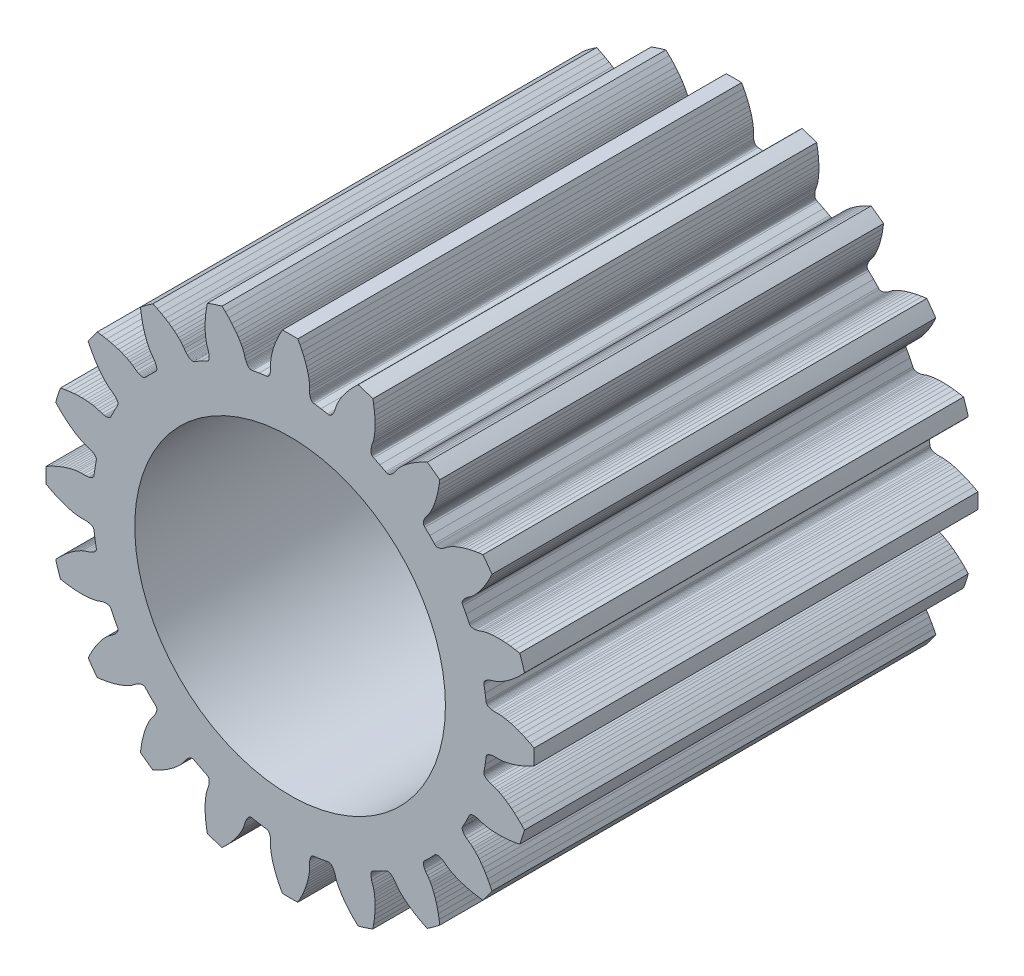
from build123d import *

# Parameters (mm, degrees)
MODEL_R             = 3.5
BOSS_EXTRUDE1_DEPTH = 10


with BuildPart() as part:
    # Model → Boss-Extrude1 (new body)
    with BuildSketch(Plane.XY):
        with BuildLine():
            Line((5.1320181, 1.3822118), (5.2098951, 1.4578457))
            Line((5.2098951, 1.4578457), (5.281849585, 1.533616799))
            ThreePointArc((5.281849585, 1.533616799), (5.230803526, 1.699591125), (5.174543391, 1.863871295))
            Line((5.174543391, 1.863871295), (5.0717939, 1.8828776))
            Line((5.0717939, 1.8828776), (4.9643336, 1.8982917))
            Line((4.9643336, 1.8982917), (4.8642841, 1.9083685))
            Line((4.8642841, 1.9083685), (4.7735596, 1.9136905))
            Line((4.7735596, 1.9136905), (4.6901277, 1.9150965))
            Line((4.6901277, 1.9150965), (4.614373, 1.9131976))
            Line((4.614373, 1.9131976), (4.5492049, 1.9088478))
            Line((4.5492049, 1.9088478), (4.4892589, 1.9023328))
            Line((4.4892589, 1.9023328), (4.4393971, 1.8947494))
            Line((4.4393971, 1.8947494), (4.3987372, 1.8868379))
            Line((4.3987372, 1.8868379), (4.3406171, 1.8719155))
            Line((4.3406171, 1.8719155), (4.2963297, 1.8558146))
            Line((4.2963297, 1.8558146), (4.2384804, 1.8370346))
            Line((4.2384804, 1.8370346), (4.1868105, 1.8260834))
            Line((4.1868105, 1.8260834), (4.1634771, 1.8233526))
            Line((4.1634771, 1.8233526), (4.1418879, 1.8223747))
            Line((4.1418879, 1.8223747), (4.1221109, 1.8230609))
            Line((4.1221109, 1.8230609), (4.1041956, 1.8253355))
            Line((4.1041956, 1.8253355), (4.0882188, 1.829114))
            Line((4.0882188, 1.829114), (4.0742257, 1.8343298))
            Line((4.0742257, 1.8343298), (4.0622618, 1.8408937))
            Line((4.0622618, 1.8408937), (4.0523813, 1.8487211))
            Line((4.0523813, 1.8487211), (4.044634, 1.8577366))
            Line((4.044634, 1.8577366), (4.0313095, 1.8844601))
            Line((4.0313095, 1.8844601), (3.964979, 2.0202577))
            Line((3.964979, 2.0202577), (3.8941045, 2.15374))
            Line((3.8941045, 2.15374), (3.8803166, 2.1802275))
            Line((3.8803166, 2.1802275), (3.8775768, 2.1917943))
            Line((3.8775768, 2.1917943), (3.8770518, 2.2043887))
            Line((3.8770518, 2.2043887), (3.8787738, 2.2179259))
            Line((3.8787738, 2.2179259), (3.882779, 2.2323123))
            Line((3.882779, 2.2323123), (3.889113, 2.2474587))
            Line((3.889113, 2.2474587), (3.8978032, 2.2632894))
            Line((3.8978032, 2.2632894), (3.9088728, 2.2796927))
            Line((3.9088728, 2.2796927), (3.9223537, 2.296584))
            Line((3.9223537, 2.296584), (3.938278, 2.313856))
            Line((3.938278, 2.313856), (3.9775085, 2.3492208))
            Line((3.9775085, 2.3492208), (4.0267048, 2.3849833))
            Line((4.0267048, 2.3849833), (4.0657622, 2.4113487))
            Line((4.0657622, 2.4113487), (4.1119968, 2.4495976))
            Line((4.1119968, 2.4495976), (4.1422966, 2.4778419))
            Line((4.1422966, 2.4778419), (4.1777397, 2.5137236))
            Line((4.1777397, 2.5137236), (4.2182458, 2.5583915))
            Line((4.2182458, 2.5583915), (4.2600698, 2.6085569))
            Line((4.2600698, 2.6085569), (4.3061335, 2.6687276))
            Line((4.3061335, 2.6687276), (4.354036, 2.7370518))
            Line((4.354036, 2.7370518), (4.403057, 2.8135776))
            Line((4.403057, 2.8135776), (4.4537123, 2.9004424))
            Line((4.4537123, 2.9004424), (4.5044056, 2.9964398))
            Line((4.5044056, 2.9964398), (4.549423792, 3.090737498))
            ThreePointArc((4.549423792, 3.090737498), (4.449587232, 3.232814344), (4.345315294, 3.371668698))
            Line((4.345315294, 3.371668698), (4.2417214, 3.3579935))
            Line((4.2417214, 3.3579935), (4.1347574, 3.3394461))
            Line((4.1347574, 3.3394461), (4.0364908, 3.3181127))
            Line((4.0364908, 3.3181127), (3.948562, 3.2951388))
            Line((3.948562, 3.2951388), (3.8687792, 3.2706941))
            Line((3.8687792, 3.2706941), (3.797319, 3.2454787))
            Line((3.797319, 3.2454787), (3.7366846, 3.2212037))
            Line((3.7366846, 3.2212037), (3.6816858, 3.1964833))
            Line((3.6816858, 3.1964833), (3.6366077, 3.1738629))
            Line((3.6366077, 3.1738629), (3.6003827, 3.153774))
            Line((3.6003827, 3.153774), (3.5497185, 3.1216219))
            Line((3.5497185, 3.1216219), (3.5125741, 3.0926234))
            Line((3.5125741, 3.0926234), (3.4633595, 3.0568863))
            Line((3.4633595, 3.0568863), (3.4176026, 3.0305041))
            Line((3.4176026, 3.0305041), (3.3962551, 3.0206965))
            Line((3.3962551, 3.0206965), (3.3760248, 3.0130951))
            Line((3.3760248, 3.0130951), (3.3570036, 3.0076363))
            Line((3.3570036, 3.0076363), (3.3392623, 3.0042634))
            Line((3.3392623, 3.0042634), (3.3228998, 3.0029199))
            Line((3.3228998, 3.0029199), (3.3079799, 3.0035563))
            Line((3.3079799, 3.0035563), (3.2945731, 3.0061018))
            Line((3.2945731, 3.0061018), (3.2827574, 3.010493))
            Line((3.2827574, 3.010493), (3.2726033, 3.0166731))
            Line((3.2726033, 3.0166731), (3.251673, 3.0379711))
            Line((3.251673, 3.0379711), (3.1466252, 3.1466252))
            Line((3.1466252, 3.1466252), (3.0379711, 3.251673))
            Line((3.0379711, 3.251673), (3.0166731, 3.2726033))
            Line((3.0166731, 3.2726033), (3.010493, 3.2827574))
            Line((3.010493, 3.2827574), (3.0061018, 3.2945731))
            Line((3.0061018, 3.2945731), (3.0035563, 3.3079799))
            Line((3.0035563, 3.3079799), (3.0029199, 3.3228998))
            Line((3.0029199, 3.3228998), (3.0042634, 3.3392623))
            Line((3.0042634, 3.3392623), (3.0076363, 3.3570036))
            Line((3.0076363, 3.3570036), (3.0130951, 3.3760248))
            Line((3.0130951, 3.3760248), (3.0206965, 3.3962551))
            Line((3.0206965, 3.3962551), (3.0305041, 3.4176026))
            Line((3.0305041, 3.4176026), (3.0568863, 3.4633595))
            Line((3.0568863, 3.4633595), (3.0926234, 3.5125741))
            Line((3.0926234, 3.5125741), (3.1216219, 3.5497185))
            Line((3.1216219, 3.5497185), (3.153774, 3.6003827))
            Line((3.153774, 3.6003827), (3.1738629, 3.6366077))
            Line((3.1738629, 3.6366077), (3.1964833, 3.6816858))
            Line((3.1964833, 3.6816858), (3.2212037, 3.7366846))
            Line((3.2212037, 3.7366846), (3.2454787, 3.797319))
            Line((3.2454787, 3.797319), (3.2706941, 3.8687792))
            Line((3.2706941, 3.8687792), (3.2951388, 3.948562))
            Line((3.2951388, 3.948562), (3.3181127, 4.0364908))
            Line((3.3181127, 4.0364908), (3.3394461, 4.1347574))
            Line((3.3394461, 4.1347574), (3.3579935, 4.2417214))
            Line((3.3579935, 4.2417214), (3.371668698, 4.345315294))
            ThreePointArc((3.371668698, 4.345315294), (3.232814327, 4.44958721), (3.090737498, 4.549423792))
            Line((3.090737498, 4.549423792), (2.9964398, 4.5044056))
            Line((2.9964398, 4.5044056), (2.9004424, 4.4537123))
            Line((2.9004424, 4.4537123), (2.8135776, 4.403057))
            Line((2.8135776, 4.403057), (2.7370518, 4.354036))
            Line((2.7370518, 4.354036), (2.6687276, 4.3061335))
            Line((2.6687276, 4.3061335), (2.6085569, 4.2600698))
            Line((2.6085569, 4.2600698), (2.5583915, 4.2182458))
            Line((2.5583915, 4.2182458), (2.5137236, 4.1777397))
            Line((2.5137236, 4.1777397), (2.4778419, 4.1422966))
            Line((2.4778419, 4.1422966), (2.4495976, 4.1119968))
            Line((2.4495976, 4.1119968), (2.4113487, 4.0657622))
            Line((2.4113487, 4.0657622), (2.3849833, 4.0267048))
            Line((2.3849833, 4.0267048), (2.3492208, 3.9775085))
            Line((2.3492208, 3.9775085), (2.313856, 3.938278))
            Line((2.313856, 3.938278), (2.296584, 3.9223537))
            Line((2.296584, 3.9223537), (2.2796927, 3.9088728))
            Line((2.2796927, 3.9088728), (2.2632894, 3.8978032))
            Line((2.2632894, 3.8978032), (2.2474587, 3.889113))
            Line((2.2474587, 3.889113), (2.2323123, 3.882779))
            Line((2.2323123, 3.882779), (2.2179259, 3.8787738))
            Line((2.2179259, 3.8787738), (2.2043887, 3.8770518))
            Line((2.2043887, 3.8770518), (2.1917943, 3.8775768))
            Line((2.1917943, 3.8775768), (2.1802275, 3.8803166))
            Line((2.1802275, 3.8803166), (2.15374, 3.8941045))
            Line((2.15374, 3.8941045), (2.0202577, 3.964979))
            Line((2.0202577, 3.964979), (1.8844601, 4.0313095))
            Line((1.8844601, 4.0313095), (1.8577366, 4.044634))
            Line((1.8577366, 4.044634), (1.8487211, 4.0523813))
            Line((1.8487211, 4.0523813), (1.8408937, 4.0622618))
            Line((1.8408937, 4.0622618), (1.8343298, 4.0742257))
            Line((1.8343298, 4.0742257), (1.829114, 4.0882188))
            Line((1.829114, 4.0882188), (1.8253355, 4.1041956))
            Line((1.8253355, 4.1041956), (1.8230609, 4.1221109))
            Line((1.8230609, 4.1221109), (1.8223747, 4.1418879))
            Line((1.8223747, 4.1418879), (1.8233526, 4.1634771))
            Line((1.8233526, 4.1634771), (1.8260834, 4.1868105))
            Line((1.8260834, 4.1868105), (1.8370346, 4.2384804))
            Line((1.8370346, 4.2384804), (1.8558146, 4.2963297))
            Line((1.8558146, 4.2963297), (1.8719155, 4.3406171))
            Line((1.8719155, 4.3406171), (1.8868379, 4.3987372))
            Line((1.8868379, 4.3987372), (1.8947494, 4.4393971))
            Line((1.8947494, 4.4393971), (1.9023328, 4.4892589))
            Line((1.9023328, 4.4892589), (1.9088478, 4.5492049))
            Line((1.9088478, 4.5492049), (1.9131976, 4.614373))
            Line((1.9131976, 4.614373), (1.9150965, 4.6901277))
            Line((1.9150965, 4.6901277), (1.9136905, 4.7735596))
            Line((1.9136905, 4.7735596), (1.9083685, 4.8642841))
            Line((1.9083685, 4.8642841), (1.8982917, 4.9643336))
            Line((1.8982917, 4.9643336), (1.8828776, 5.0717939))
            Line((1.8828776, 5.0717939), (1.863871285, 5.174543358))
            ThreePointArc((1.863871285, 5.174543358), (1.699591115, 5.230803492), (1.533616791, 5.281849558))
            Line((1.533616791, 5.281849558), (1.4578457, 5.2098951))
            Line((1.4578457, 5.2098951), (1.3822118, 5.1320181))
            Line((1.3822118, 5.1320181), (1.3152519, 5.0569993))
            Line((1.3152519, 5.0569993), (1.2576198, 4.9867298))
            Line((1.2576198, 4.9867298), (1.2074423, 4.9200585))
            Line((1.2074423, 4.9200585), (1.1644511, 4.8576555))
            Line((1.1644511, 4.8576555), (1.1296653, 4.8023766))
            Line((1.1296653, 4.8023766), (1.0997007, 4.7500499))
            Line((1.0997007, 4.7500499), (1.0765276, 4.7052535))
            Line((1.0765276, 4.7052535), (1.0590289, 4.6677086))
            Line((1.0590289, 4.6677086), (1.0369393, 4.6119173))
            Line((1.0369393, 4.6119173), (1.0239337, 4.5666242))
            Line((1.0239337, 4.5666242), (1.005124, 4.5087846))
            Line((1.005124, 4.5087846), (0.983613, 4.4605457))
            Line((0.983613, 4.4605457), (0.9721072, 4.4400635))
            Line((0.9721072, 4.4400635), (0.9602085, 4.4220227))
            Line((0.9602085, 4.4220227), (0.9480287, 4.4064261))
            Line((0.9480287, 4.4064261), (0.9356582, 4.3932692))
            Line((0.9356582, 4.3932692), (0.9232104, 4.3825647))
            Line((0.9232104, 4.3825647), (0.9107659, 4.3743098))
            Line((0.9107659, 4.3743098), (0.8984233, 4.368489))
            Line((0.8984233, 4.368489), (0.8862831, 4.3650964))
            Line((0.8862831, 4.3650964), (0.8744357, 4.3641278))
            Line((0.8744357, 4.3641278), (0.844984, 4.3690557))
            Line((0.844984, 4.3690557), (0.6961334, 4.3952131))
            Line((0.6961334, 4.3952131), (0.5464849, 4.4163333))
            Line((0.5464849, 4.4163333), (0.5169518, 4.4207477))
            Line((0.5169518, 4.4207477), (0.5059836, 4.4253299))
            Line((0.5059836, 4.4253299), (0.495486, 4.432308))
            Line((0.495486, 4.432308), (0.4855463, 4.441658))
            Line((0.4855463, 4.441658), (0.4762617, 4.4533544))
            Line((0.4762617, 4.4533544), (0.467731, 4.4673816))
            Line((0.467731, 4.4673816), (0.4600317, 4.4837172))
            Line((0.4600317, 4.4837172), (0.4532676, 4.5023143))
            Line((0.4532676, 4.5023143), (0.4475262, 4.523149))
            Line((0.4475262, 4.523149), (0.4429129, 4.5461842))
            Line((0.4429129, 4.5461842), (0.4373613, 4.5987094))
            Line((0.4373613, 4.5987094), (0.4373456, 4.6595306))
            Line((0.4373456, 4.6595306), (0.438973, 4.7066259))
            Line((0.438973, 4.7066259), (0.4352049, 4.7665126))
            Line((0.4352049, 4.7665126), (0.4301646, 4.8076273))
            Line((0.4301646, 4.8076273), (0.4219687, 4.8573921))
            Line((0.4219687, 4.8573921), (0.4096405, 4.9164174))
            Line((0.4096405, 4.9164174), (0.3936393, 4.9797401))
            Line((0.3936393, 4.9797401), (0.3720358, 5.0523739))
            Line((0.3720358, 5.0523739), (0.3449168, 5.1312878))
            Line((0.3449168, 5.1312878), (0.3118198, 5.2159274))
            Line((0.3118198, 5.2159274), (0.2713192, 5.3079662))
            Line((0.2713192, 5.3079662), (0.2234525, 5.4054038))
            Line((0.2234525, 5.4054038), (0.173625002, 5.497251101))
            ThreePointArc((0.173625002, 5.497251101), (-4.7e-08, 5.499992301), (-0.173625097, 5.497251104))
            Line((-0.173625097, 5.497251104), (-0.2234525, 5.4054038))
            Line((-0.2234525, 5.4054038), (-0.2713192, 5.3079662))
            Line((-0.2713192, 5.3079662), (-0.3118198, 5.2159274))
            Line((-0.3118198, 5.2159274), (-0.3449168, 5.1312878))
            Line((-0.3449168, 5.1312878), (-0.3720358, 5.0523739))
            Line((-0.3720358, 5.0523739), (-0.3936393, 4.9797401))
            Line((-0.3936393, 4.9797401), (-0.4096405, 4.9164174))
            Line((-0.4096405, 4.9164174), (-0.4219687, 4.8573921))
            Line((-0.4219687, 4.8573921), (-0.4301646, 4.8076273))
            Line((-0.4301646, 4.8076273), (-0.4352049, 4.7665126))
            Line((-0.4352049, 4.7665126), (-0.438973, 4.7066259))
            Line((-0.438973, 4.7066259), (-0.4373456, 4.6595306))
            Line((-0.4373456, 4.6595306), (-0.4373613, 4.5987094))
            Line((-0.4373613, 4.5987094), (-0.4429129, 4.5461842))
            Line((-0.4429129, 4.5461842), (-0.4475262, 4.523149))
            Line((-0.4475262, 4.523149), (-0.4532676, 4.5023143))
            Line((-0.4532676, 4.5023143), (-0.4600317, 4.4837172))
            Line((-0.4600317, 4.4837172), (-0.467731, 4.4673816))
            Line((-0.467731, 4.4673816), (-0.4762617, 4.4533544))
            Line((-0.4762617, 4.4533544), (-0.4855463, 4.441658))
            Line((-0.4855463, 4.441658), (-0.495486, 4.432308))
            Line((-0.495486, 4.432308), (-0.5059836, 4.4253299))
            Line((-0.5059836, 4.4253299), (-0.5169518, 4.4207477))
            Line((-0.5169518, 4.4207477), (-0.5464849, 4.4163333))
            Line((-0.5464849, 4.4163333), (-0.6961334, 4.3952131))
            Line((-0.6961334, 4.3952131), (-0.844984, 4.3690557))
            Line((-0.844984, 4.3690557), (-0.8744357, 4.3641278))
            Line((-0.8744357, 4.3641278), (-0.8862831, 4.3650964))
            Line((-0.8862831, 4.3650964), (-0.8984233, 4.368489))
            Line((-0.8984233, 4.368489), (-0.9107659, 4.3743098))
            Line((-0.9107659, 4.3743098), (-0.9232104, 4.3825647))
            Line((-0.9232104, 4.3825647), (-0.9356582, 4.3932692))
            Line((-0.9356582, 4.3932692), (-0.9480287, 4.4064261))
            Line((-0.9480287, 4.4064261), (-0.9602085, 4.4220227))
            Line((-0.9602085, 4.4220227), (-0.9721072, 4.4400635))
            Line((-0.9721072, 4.4400635), (-0.983613, 4.4605457))
            Line((-0.983613, 4.4605457), (-1.005124, 4.5087846))
            Line((-1.005124, 4.5087846), (-1.0239337, 4.5666242))
            Line((-1.0239337, 4.5666242), (-1.0369393, 4.6119173))
            Line((-1.0369393, 4.6119173), (-1.0590289, 4.6677086))
            Line((-1.0590289, 4.6677086), (-1.0765276, 4.7052535))
            Line((-1.0765276, 4.7052535), (-1.0997007, 4.7500499))
            Line((-1.0997007, 4.7500499), (-1.1296653, 4.8023766))
            Line((-1.1296653, 4.8023766), (-1.1644511, 4.8576555))
            Line((-1.1644511, 4.8576555), (-1.2074423, 4.9200585))
            Line((-1.2074423, 4.9200585), (-1.2576198, 4.9867298))
            Line((-1.2576198, 4.9867298), (-1.3152519, 5.0569993))
            Line((-1.3152519, 5.0569993), (-1.3822118, 5.1320181))
            Line((-1.3822118, 5.1320181), (-1.4578457, 5.2098951))
            Line((-1.4578457, 5.2098951), (-1.533616799, 5.281849585))
            ThreePointArc((-1.533616799, 5.281849585), (-1.699591125, 5.230803526), (-1.863871295, 5.174543391))
            Line((-1.863871295, 5.174543391), (-1.8828776, 5.0717939))
            Line((-1.8828776, 5.0717939), (-1.8982917, 4.9643336))
            Line((-1.8982917, 4.9643336), (-1.9083685, 4.8642841))
            Line((-1.9083685, 4.8642841), (-1.9136905, 4.7735596))
            Line((-1.9136905, 4.7735596), (-1.9150965, 4.6901277))
            Line((-1.9150965, 4.6901277), (-1.9131976, 4.614373))
            Line((-1.9131976, 4.614373), (-1.9088478, 4.5492049))
            Line((-1.9088478, 4.5492049), (-1.9023328, 4.4892589))
            Line((-1.9023328, 4.4892589), (-1.8947494, 4.4393971))
            Line((-1.8947494, 4.4393971), (-1.8868379, 4.3987372))
            Line((-1.8868379, 4.3987372), (-1.8719155, 4.3406171))
            Line((-1.8719155, 4.3406171), (-1.8558146, 4.2963297))
            Line((-1.8558146, 4.2963297), (-1.8370346, 4.2384804))
            Line((-1.8370346, 4.2384804), (-1.8260834, 4.1868105))
            Line((-1.8260834, 4.1868105), (-1.8233526, 4.1634771))
            Line((-1.8233526, 4.1634771), (-1.8223747, 4.1418879))
            Line((-1.8223747, 4.1418879), (-1.8230609, 4.1221109))
            Line((-1.8230609, 4.1221109), (-1.8253355, 4.1041956))
            Line((-1.8253355, 4.1041956), (-1.829114, 4.0882188))
            Line((-1.829114, 4.0882188), (-1.8343298, 4.0742257))
            Line((-1.8343298, 4.0742257), (-1.8408937, 4.0622618))
            Line((-1.8408937, 4.0622618), (-1.8487211, 4.0523813))
            Line((-1.8487211, 4.0523813), (-1.8577366, 4.044634))
            Line((-1.8577366, 4.044634), (-1.8844601, 4.0313095))
            Line((-1.8844601, 4.0313095), (-2.0202577, 3.964979))
            Line((-2.0202577, 3.964979), (-2.15374, 3.8941045))
            Line((-2.15374, 3.8941045), (-2.1802275, 3.8803166))
            Line((-2.1802275, 3.8803166), (-2.1917943, 3.8775768))
            Line((-2.1917943, 3.8775768), (-2.2043887, 3.8770518))
            Line((-2.2043887, 3.8770518), (-2.2179259, 3.8787738))
            Line((-2.2179259, 3.8787738), (-2.2323123, 3.882779))
            Line((-2.2323123, 3.882779), (-2.2474587, 3.889113))
            Line((-2.2474587, 3.889113), (-2.2632894, 3.8978032))
            Line((-2.2632894, 3.8978032), (-2.2796927, 3.9088728))
            Line((-2.2796927, 3.9088728), (-2.296584, 3.9223537))
            Line((-2.296584, 3.9223537), (-2.313856, 3.938278))
            Line((-2.313856, 3.938278), (-2.3492208, 3.9775085))
            Line((-2.3492208, 3.9775085), (-2.3849833, 4.0267048))
            Line((-2.3849833, 4.0267048), (-2.4113487, 4.0657622))
            Line((-2.4113487, 4.0657622), (-2.4495976, 4.1119968))
            Line((-2.4495976, 4.1119968), (-2.4778419, 4.1422966))
            Line((-2.4778419, 4.1422966), (-2.5137236, 4.1777397))
            Line((-2.5137236, 4.1777397), (-2.5583915, 4.2182458))
            Line((-2.5583915, 4.2182458), (-2.6085569, 4.2600698))
            Line((-2.6085569, 4.2600698), (-2.6687276, 4.3061335))
            Line((-2.6687276, 4.3061335), (-2.7370518, 4.354036))
            Line((-2.7370518, 4.354036), (-2.8135776, 4.403057))
            Line((-2.8135776, 4.403057), (-2.9004424, 4.4537123))
            Line((-2.9004424, 4.4537123), (-2.9964398, 4.5044056))
            Line((-2.9964398, 4.5044056), (-3.090737498, 4.549423792))
            ThreePointArc((-3.090737498, 4.549423792), (-3.232814344, 4.449587232), (-3.371668698, 4.345315294))
            Line((-3.371668698, 4.345315294), (-3.3579935, 4.2417214))
            Line((-3.3579935, 4.2417214), (-3.3394461, 4.1347574))
            Line((-3.3394461, 4.1347574), (-3.3181127, 4.0364908))
            Line((-3.3181127, 4.0364908), (-3.2951388, 3.948562))
            Line((-3.2951388, 3.948562), (-3.2706941, 3.8687792))
            Line((-3.2706941, 3.8687792), (-3.2454787, 3.797319))
            Line((-3.2454787, 3.797319), (-3.2212037, 3.7366846))
            Line((-3.2212037, 3.7366846), (-3.1964833, 3.6816858))
            Line((-3.1964833, 3.6816858), (-3.1738629, 3.6366077))
            Line((-3.1738629, 3.6366077), (-3.153774, 3.6003827))
            Line((-3.153774, 3.6003827), (-3.1216219, 3.5497185))
            Line((-3.1216219, 3.5497185), (-3.0926234, 3.5125741))
            Line((-3.0926234, 3.5125741), (-3.0568863, 3.4633595))
            Line((-3.0568863, 3.4633595), (-3.0305041, 3.4176026))
            Line((-3.0305041, 3.4176026), (-3.0206965, 3.3962551))
            Line((-3.0206965, 3.3962551), (-3.0130951, 3.3760248))
            Line((-3.0130951, 3.3760248), (-3.0076363, 3.3570036))
            Line((-3.0076363, 3.3570036), (-3.0042634, 3.3392623))
            Line((-3.0042634, 3.3392623), (-3.0029199, 3.3228998))
            Line((-3.0029199, 3.3228998), (-3.0035563, 3.3079799))
            Line((-3.0035563, 3.3079799), (-3.0061018, 3.2945731))
            Line((-3.0061018, 3.2945731), (-3.010493, 3.2827574))
            Line((-3.010493, 3.2827574), (-3.0166731, 3.2726033))
            Line((-3.0166731, 3.2726033), (-3.0379711, 3.251673))
            Line((-3.0379711, 3.251673), (-3.1466252, 3.1466252))
            Line((-3.1466252, 3.1466252), (-3.251673, 3.0379711))
            Line((-3.251673, 3.0379711), (-3.2726033, 3.0166731))
            Line((-3.2726033, 3.0166731), (-3.2827574, 3.010493))
            Line((-3.2827574, 3.010493), (-3.2945731, 3.0061018))
            Line((-3.2945731, 3.0061018), (-3.3079799, 3.0035563))
            Line((-3.3079799, 3.0035563), (-3.3228998, 3.0029199))
            Line((-3.3228998, 3.0029199), (-3.3392623, 3.0042634))
            Line((-3.3392623, 3.0042634), (-3.3570036, 3.0076363))
            Line((-3.3570036, 3.0076363), (-3.3760248, 3.0130951))
            Line((-3.3760248, 3.0130951), (-3.3962551, 3.0206965))
            Line((-3.3962551, 3.0206965), (-3.4176026, 3.0305041))
            Line((-3.4176026, 3.0305041), (-3.4633595, 3.0568863))
            Line((-3.4633595, 3.0568863), (-3.5125741, 3.0926234))
            Line((-3.5125741, 3.0926234), (-3.5497185, 3.1216219))
            Line((-3.5497185, 3.1216219), (-3.6003827, 3.153774))
            Line((-3.6003827, 3.153774), (-3.6366077, 3.1738629))
            Line((-3.6366077, 3.1738629), (-3.6816858, 3.1964833))
            Line((-3.6816858, 3.1964833), (-3.7366846, 3.2212037))
            Line((-3.7366846, 3.2212037), (-3.797319, 3.2454787))
            Line((-3.797319, 3.2454787), (-3.8687792, 3.2706941))
            Line((-3.8687792, 3.2706941), (-3.948562, 3.2951388))
            Line((-3.948562, 3.2951388), (-4.0364908, 3.3181127))
            Line((-4.0364908, 3.3181127), (-4.1347574, 3.3394461))
            Line((-4.1347574, 3.3394461), (-4.2417214, 3.3579935))
            Line((-4.2417214, 3.3579935), (-4.345315294, 3.371668698))
            ThreePointArc((-4.345315294, 3.371668698), (-4.44958721, 3.232814327), (-4.549423792, 3.090737498))
            Line((-4.549423792, 3.090737498), (-4.5044056, 2.9964398))
            Line((-4.5044056, 2.9964398), (-4.4537123, 2.9004424))
            Line((-4.4537123, 2.9004424), (-4.403057, 2.8135776))
            Line((-4.403057, 2.8135776), (-4.354036, 2.7370518))
            Line((-4.354036, 2.7370518), (-4.3061335, 2.6687276))
            Line((-4.3061335, 2.6687276), (-4.2600698, 2.6085569))
            Line((-4.2600698, 2.6085569), (-4.2182458, 2.5583915))
            Line((-4.2182458, 2.5583915), (-4.1777397, 2.5137236))
            Line((-4.1777397, 2.5137236), (-4.1422966, 2.4778419))
            Line((-4.1422966, 2.4778419), (-4.1119968, 2.4495976))
            Line((-4.1119968, 2.4495976), (-4.0657622, 2.4113487))
            Line((-4.0657622, 2.4113487), (-4.0267048, 2.3849833))
            Line((-4.0267048, 2.3849833), (-3.9775085, 2.3492208))
            Line((-3.9775085, 2.3492208), (-3.938278, 2.313856))
            Line((-3.938278, 2.313856), (-3.9223537, 2.296584))
            Line((-3.9223537, 2.296584), (-3.9088728, 2.2796927))
            Line((-3.9088728, 2.2796927), (-3.8978032, 2.2632894))
            Line((-3.8978032, 2.2632894), (-3.889113, 2.2474587))
            Line((-3.889113, 2.2474587), (-3.882779, 2.2323123))
            Line((-3.882779, 2.2323123), (-3.8787738, 2.2179259))
            Line((-3.8787738, 2.2179259), (-3.8770518, 2.2043887))
            Line((-3.8770518, 2.2043887), (-3.8775768, 2.1917943))
            Line((-3.8775768, 2.1917943), (-3.8803166, 2.1802275))
            Line((-3.8803166, 2.1802275), (-3.8941045, 2.15374))
            Line((-3.8941045, 2.15374), (-3.964979, 2.0202577))
            Line((-3.964979, 2.0202577), (-4.0313095, 1.8844601))
            Line((-4.0313095, 1.8844601), (-4.044634, 1.8577366))
            Line((-4.044634, 1.8577366), (-4.0523813, 1.8487211))
            Line((-4.0523813, 1.8487211), (-4.0622618, 1.8408937))
            Line((-4.0622618, 1.8408937), (-4.0742257, 1.8343298))
            Line((-4.0742257, 1.8343298), (-4.0882188, 1.829114))
            Line((-4.0882188, 1.829114), (-4.1041956, 1.8253355))
            Line((-4.1041956, 1.8253355), (-4.1221109, 1.8230609))
            Line((-4.1221109, 1.8230609), (-4.1418879, 1.8223747))
            Line((-4.1418879, 1.8223747), (-4.1634771, 1.8233526))
            Line((-4.1634771, 1.8233526), (-4.1868105, 1.8260834))
            Line((-4.1868105, 1.8260834), (-4.2384804, 1.8370346))
            Line((-4.2384804, 1.8370346), (-4.2963297, 1.8558146))
            Line((-4.2963297, 1.8558146), (-4.3406171, 1.8719155))
            Line((-4.3406171, 1.8719155), (-4.3987372, 1.8868379))
            Line((-4.3987372, 1.8868379), (-4.4393971, 1.8947494))
            Line((-4.4393971, 1.8947494), (-4.4892589, 1.9023328))
            Line((-4.4892589, 1.9023328), (-4.5492049, 1.9088478))
            Line((-4.5492049, 1.9088478), (-4.614373, 1.9131976))
            Line((-4.614373, 1.9131976), (-4.6901277, 1.9150965))
            Line((-4.6901277, 1.9150965), (-4.7735596, 1.9136905))
            Line((-4.7735596, 1.9136905), (-4.8642841, 1.9083685))
            Line((-4.8642841, 1.9083685), (-4.9643336, 1.8982917))
            Line((-4.9643336, 1.8982917), (-5.0717939, 1.8828776))
            Line((-5.0717939, 1.8828776), (-5.174543358, 1.863871285))
            ThreePointArc((-5.174543358, 1.863871285), (-5.230803492, 1.699591115), (-5.281849558, 1.533616791))
            Line((-5.281849558, 1.533616791), (-5.2098951, 1.4578457))
            Line((-5.2098951, 1.4578457), (-5.1320181, 1.3822118))
            Line((-5.1320181, 1.3822118), (-5.0569993, 1.3152519))
            Line((-5.0569993, 1.3152519), (-4.9867298, 1.2576198))
            Line((-4.9867298, 1.2576198), (-4.9200585, 1.2074423))
            Line((-4.9200585, 1.2074423), (-4.8576555, 1.1644511))
            Line((-4.8576555, 1.1644511), (-4.8023766, 1.1296653))
            Line((-4.8023766, 1.1296653), (-4.7500499, 1.0997007))
            Line((-4.7500499, 1.0997007), (-4.7052535, 1.0765276))
            Line((-4.7052535, 1.0765276), (-4.6677086, 1.0590289))
            Line((-4.6677086, 1.0590289), (-4.6119173, 1.0369393))
            Line((-4.6119173, 1.0369393), (-4.5666242, 1.0239337))
            Line((-4.5666242, 1.0239337), (-4.5087846, 1.005124))
            Line((-4.5087846, 1.005124), (-4.4605457, 0.983613))
            Line((-4.4605457, 0.983613), (-4.4400635, 0.9721072))
            Line((-4.4400635, 0.9721072), (-4.4220227, 0.9602085))
            Line((-4.4220227, 0.9602085), (-4.4064261, 0.9480287))
            Line((-4.4064261, 0.9480287), (-4.3932692, 0.9356582))
            Line((-4.3932692, 0.9356582), (-4.3825647, 0.9232104))
            Line((-4.3825647, 0.9232104), (-4.3743098, 0.9107659))
            Line((-4.3743098, 0.9107659), (-4.368489, 0.8984233))
            Line((-4.368489, 0.8984233), (-4.3650964, 0.8862831))
            Line((-4.3650964, 0.8862831), (-4.3641278, 0.8744357))
            Line((-4.3641278, 0.8744357), (-4.3690557, 0.844984))
            Line((-4.3690557, 0.844984), (-4.3952131, 0.6961334))
            Line((-4.3952131, 0.6961334), (-4.4163333, 0.5464849))
            Line((-4.4163333, 0.5464849), (-4.4207477, 0.5169518))
            Line((-4.4207477, 0.5169518), (-4.4253299, 0.5059836))
            Line((-4.4253299, 0.5059836), (-4.432308, 0.495486))
            Line((-4.432308, 0.495486), (-4.441658, 0.4855463))
            Line((-4.441658, 0.4855463), (-4.4533544, 0.4762617))
            Line((-4.4533544, 0.4762617), (-4.4673816, 0.467731))
            Line((-4.4673816, 0.467731), (-4.4837172, 0.4600317))
            Line((-4.4837172, 0.4600317), (-4.5023143, 0.4532676))
            Line((-4.5023143, 0.4532676), (-4.523149, 0.4475262))
            Line((-4.523149, 0.4475262), (-4.5461842, 0.4429129))
            Line((-4.5461842, 0.4429129), (-4.5987094, 0.4373613))
            Line((-4.5987094, 0.4373613), (-4.6595306, 0.4373456))
            Line((-4.6595306, 0.4373456), (-4.7066259, 0.438973))
            Line((-4.7066259, 0.438973), (-4.7665126, 0.4352049))
            Line((-4.7665126, 0.4352049), (-4.8076273, 0.4301646))
            Line((-4.8076273, 0.4301646), (-4.8573921, 0.4219687))
            Line((-4.8573921, 0.4219687), (-4.9164174, 0.4096405))
            Line((-4.9164174, 0.4096405), (-4.9797401, 0.3936393))
            Line((-4.9797401, 0.3936393), (-5.0523739, 0.3720358))
            Line((-5.0523739, 0.3720358), (-5.1312878, 0.3449168))
            Line((-5.1312878, 0.3449168), (-5.2159274, 0.3118198))
            Line((-5.2159274, 0.3118198), (-5.3079662, 0.2713192))
            Line((-5.3079662, 0.2713192), (-5.4054038, 0.2234525))
            Line((-5.4054038, 0.2234525), (-5.497251101, 0.173625002))
            ThreePointArc((-5.497251101, 0.173625002), (-5.499992301, -4.7e-08), (-5.497251104, -0.173625097))
            Line((-5.497251104, -0.173625097), (-5.4054038, -0.2234525))
            Line((-5.4054038, -0.2234525), (-5.3079662, -0.2713192))
            Line((-5.3079662, -0.2713192), (-5.2159274, -0.3118198))
            Line((-5.2159274, -0.3118198), (-5.1312878, -0.3449168))
            Line((-5.1312878, -0.3449168), (-5.0523739, -0.3720358))
            Line((-5.0523739, -0.3720358), (-4.9797401, -0.3936393))
            Line((-4.9797401, -0.3936393), (-4.9164174, -0.4096405))
            Line((-4.9164174, -0.4096405), (-4.8573921, -0.4219687))
            Line((-4.8573921, -0.4219687), (-4.8076273, -0.4301646))
            Line((-4.8076273, -0.4301646), (-4.7665126, -0.4352049))
            Line((-4.7665126, -0.4352049), (-4.7066259, -0.438973))
            Line((-4.7066259, -0.438973), (-4.6595306, -0.4373456))
            Line((-4.6595306, -0.4373456), (-4.5987094, -0.4373613))
            Line((-4.5987094, -0.4373613), (-4.5461842, -0.4429129))
            Line((-4.5461842, -0.4429129), (-4.523149, -0.4475262))
            Line((-4.523149, -0.4475262), (-4.5023143, -0.4532676))
            Line((-4.5023143, -0.4532676), (-4.4837172, -0.4600317))
            Line((-4.4837172, -0.4600317), (-4.4673816, -0.467731))
            Line((-4.4673816, -0.467731), (-4.4533544, -0.4762617))
            Line((-4.4533544, -0.4762617), (-4.441658, -0.4855463))
            Line((-4.441658, -0.4855463), (-4.432308, -0.495486))
            Line((-4.432308, -0.495486), (-4.4253299, -0.5059836))
            Line((-4.4253299, -0.5059836), (-4.4207477, -0.5169518))
            Line((-4.4207477, -0.5169518), (-4.4163333, -0.5464849))
            Line((-4.4163333, -0.5464849), (-4.3952131, -0.6961334))
            Line((-4.3952131, -0.6961334), (-4.3690557, -0.844984))
            Line((-4.3690557, -0.844984), (-4.3641278, -0.8744357))
            Line((-4.3641278, -0.8744357), (-4.3650964, -0.8862831))
            Line((-4.3650964, -0.8862831), (-4.368489, -0.8984233))
            Line((-4.368489, -0.8984233), (-4.3743098, -0.9107659))
            Line((-4.3743098, -0.9107659), (-4.3825647, -0.9232104))
            Line((-4.3825647, -0.9232104), (-4.3932692, -0.9356582))
            Line((-4.3932692, -0.9356582), (-4.4064261, -0.9480287))
            Line((-4.4064261, -0.9480287), (-4.4220227, -0.9602085))
            Line((-4.4220227, -0.9602085), (-4.4400635, -0.9721072))
            Line((-4.4400635, -0.9721072), (-4.4605457, -0.983613))
            Line((-4.4605457, -0.983613), (-4.5087846, -1.005124))
            Line((-4.5087846, -1.005124), (-4.5666242, -1.0239337))
            Line((-4.5666242, -1.0239337), (-4.6119173, -1.0369393))
            Line((-4.6119173, -1.0369393), (-4.6677086, -1.0590289))
            Line((-4.6677086, -1.0590289), (-4.7052535, -1.0765276))
            Line((-4.7052535, -1.0765276), (-4.7500499, -1.0997007))
            Line((-4.7500499, -1.0997007), (-4.8023766, -1.1296653))
            Line((-4.8023766, -1.1296653), (-4.8576555, -1.1644511))
            Line((-4.8576555, -1.1644511), (-4.9200585, -1.2074423))
            Line((-4.9200585, -1.2074423), (-4.9867298, -1.2576198))
            Line((-4.9867298, -1.2576198), (-5.0569993, -1.3152519))
            Line((-5.0569993, -1.3152519), (-5.1320181, -1.3822118))
            Line((-5.1320181, -1.3822118), (-5.2098951, -1.4578457))
            Line((-5.2098951, -1.4578457), (-5.281849585, -1.533616799))
            ThreePointArc((-5.281849585, -1.533616799), (-5.230803526, -1.699591125), (-5.174543391, -1.863871295))
            Line((-5.174543391, -1.863871295), (-5.0717939, -1.8828776))
            Line((-5.0717939, -1.8828776), (-4.9643336, -1.8982917))
            Line((-4.9643336, -1.8982917), (-4.8642841, -1.9083685))
            Line((-4.8642841, -1.9083685), (-4.7735596, -1.9136905))
            Line((-4.7735596, -1.9136905), (-4.6901277, -1.9150965))
            Line((-4.6901277, -1.9150965), (-4.614373, -1.9131976))
            Line((-4.614373, -1.9131976), (-4.5492049, -1.9088478))
            Line((-4.5492049, -1.9088478), (-4.4892589, -1.9023328))
            Line((-4.4892589, -1.9023328), (-4.4393971, -1.8947494))
            Line((-4.4393971, -1.8947494), (-4.3987372, -1.8868379))
            Line((-4.3987372, -1.8868379), (-4.3406171, -1.8719155))
            Line((-4.3406171, -1.8719155), (-4.2963297, -1.8558146))
            Line((-4.2963297, -1.8558146), (-4.2384804, -1.8370346))
            Line((-4.2384804, -1.8370346), (-4.1868105, -1.8260834))
            Line((-4.1868105, -1.8260834), (-4.1634771, -1.8233526))
            Line((-4.1634771, -1.8233526), (-4.1418879, -1.8223747))
            Line((-4.1418879, -1.8223747), (-4.1221109, -1.8230609))
            Line((-4.1221109, -1.8230609), (-4.1041956, -1.8253355))
            Line((-4.1041956, -1.8253355), (-4.0882188, -1.829114))
            Line((-4.0882188, -1.829114), (-4.0742257, -1.8343298))
            Line((-4.0742257, -1.8343298), (-4.0622618, -1.8408937))
            Line((-4.0622618, -1.8408937), (-4.0523813, -1.8487211))
            Line((-4.0523813, -1.8487211), (-4.044634, -1.8577366))
            Line((-4.044634, -1.8577366), (-4.0313095, -1.8844601))
            Line((-4.0313095, -1.8844601), (-3.964979, -2.0202577))
            Line((-3.964979, -2.0202577), (-3.8941045, -2.15374))
            Line((-3.8941045, -2.15374), (-3.8803166, -2.1802275))
            Line((-3.8803166, -2.1802275), (-3.8775768, -2.1917943))
            Line((-3.8775768, -2.1917943), (-3.8770518, -2.2043887))
            Line((-3.8770518, -2.2043887), (-3.8787738, -2.2179259))
            Line((-3.8787738, -2.2179259), (-3.882779, -2.2323123))
            Line((-3.882779, -2.2323123), (-3.889113, -2.2474587))
            Line((-3.889113, -2.2474587), (-3.8978032, -2.2632894))
            Line((-3.8978032, -2.2632894), (-3.9088728, -2.2796927))
            Line((-3.9088728, -2.2796927), (-3.9223537, -2.296584))
            Line((-3.9223537, -2.296584), (-3.938278, -2.313856))
            Line((-3.938278, -2.313856), (-3.9775085, -2.3492208))
            Line((-3.9775085, -2.3492208), (-4.0267048, -2.3849833))
            Line((-4.0267048, -2.3849833), (-4.0657622, -2.4113487))
            Line((-4.0657622, -2.4113487), (-4.1119968, -2.4495976))
            Line((-4.1119968, -2.4495976), (-4.1422966, -2.4778419))
            Line((-4.1422966, -2.4778419), (-4.1777397, -2.5137236))
            Line((-4.1777397, -2.5137236), (-4.2182458, -2.5583915))
            Line((-4.2182458, -2.5583915), (-4.2600698, -2.6085569))
            Line((-4.2600698, -2.6085569), (-4.3061335, -2.6687276))
            Line((-4.3061335, -2.6687276), (-4.354036, -2.7370518))
            Line((-4.354036, -2.7370518), (-4.403057, -2.8135776))
            Line((-4.403057, -2.8135776), (-4.4537123, -2.9004424))
            Line((-4.4537123, -2.9004424), (-4.5044056, -2.9964398))
            Line((-4.5044056, -2.9964398), (-4.549423792, -3.090737498))
            ThreePointArc((-4.549423792, -3.090737498), (-4.449587232, -3.232814344), (-4.345315294, -3.371668698))
            Line((-4.345315294, -3.371668698), (-4.2417214, -3.3579935))
            Line((-4.2417214, -3.3579935), (-4.1347574, -3.3394461))
            Line((-4.1347574, -3.3394461), (-4.0364908, -3.3181127))
            Line((-4.0364908, -3.3181127), (-3.948562, -3.2951388))
            Line((-3.948562, -3.2951388), (-3.8687792, -3.2706941))
            Line((-3.8687792, -3.2706941), (-3.797319, -3.2454787))
            Line((-3.797319, -3.2454787), (-3.7366846, -3.2212037))
            Line((-3.7366846, -3.2212037), (-3.6816858, -3.1964833))
            Line((-3.6816858, -3.1964833), (-3.6366077, -3.1738629))
            Line((-3.6366077, -3.1738629), (-3.6003827, -3.153774))
            Line((-3.6003827, -3.153774), (-3.5497185, -3.1216219))
            Line((-3.5497185, -3.1216219), (-3.5125741, -3.0926234))
            Line((-3.5125741, -3.0926234), (-3.4633595, -3.0568863))
            Line((-3.4633595, -3.0568863), (-3.4176026, -3.0305041))
            Line((-3.4176026, -3.0305041), (-3.3962551, -3.0206965))
            Line((-3.3962551, -3.0206965), (-3.3760248, -3.0130951))
            Line((-3.3760248, -3.0130951), (-3.3570036, -3.0076363))
            Line((-3.3570036, -3.0076363), (-3.3392623, -3.0042634))
            Line((-3.3392623, -3.0042634), (-3.3228998, -3.0029199))
            Line((-3.3228998, -3.0029199), (-3.3079799, -3.0035563))
            Line((-3.3079799, -3.0035563), (-3.2945731, -3.0061018))
            Line((-3.2945731, -3.0061018), (-3.2827574, -3.010493))
            Line((-3.2827574, -3.010493), (-3.2726033, -3.0166731))
            Line((-3.2726033, -3.0166731), (-3.251673, -3.0379711))
            Line((-3.251673, -3.0379711), (-3.1466252, -3.1466252))
            Line((-3.1466252, -3.1466252), (-3.0379711, -3.251673))
            Line((-3.0379711, -3.251673), (-3.0166731, -3.2726033))
            Line((-3.0166731, -3.2726033), (-3.010493, -3.2827574))
            Line((-3.010493, -3.2827574), (-3.0061018, -3.2945731))
            Line((-3.0061018, -3.2945731), (-3.0035563, -3.3079799))
            Line((-3.0035563, -3.3079799), (-3.0029199, -3.3228998))
            Line((-3.0029199, -3.3228998), (-3.0042634, -3.3392623))
            Line((-3.0042634, -3.3392623), (-3.0076363, -3.3570036))
            Line((-3.0076363, -3.3570036), (-3.0130951, -3.3760248))
            Line((-3.0130951, -3.3760248), (-3.0206965, -3.3962551))
            Line((-3.0206965, -3.3962551), (-3.0305041, -3.4176026))
            Line((-3.0305041, -3.4176026), (-3.0568863, -3.4633595))
            Line((-3.0568863, -3.4633595), (-3.0926234, -3.5125741))
            Line((-3.0926234, -3.5125741), (-3.1216219, -3.5497185))
            Line((-3.1216219, -3.5497185), (-3.153774, -3.6003827))
            Line((-3.153774, -3.6003827), (-3.1738629, -3.6366077))
            Line((-3.1738629, -3.6366077), (-3.1964833, -3.6816858))
            Line((-3.1964833, -3.6816858), (-3.2212037, -3.7366846))
            Line((-3.2212037, -3.7366846), (-3.2454787, -3.797319))
            Line((-3.2454787, -3.797319), (-3.2706941, -3.8687792))
            Line((-3.2706941, -3.8687792), (-3.2951388, -3.948562))
            Line((-3.2951388, -3.948562), (-3.3181127, -4.0364908))
            Line((-3.3181127, -4.0364908), (-3.3394461, -4.1347574))
            Line((-3.3394461, -4.1347574), (-3.3579935, -4.2417214))
            Line((-3.3579935, -4.2417214), (-3.371668698, -4.345315294))
            ThreePointArc((-3.371668698, -4.345315294), (-3.232814327, -4.44958721), (-3.090737498, -4.549423792))
            Line((-3.090737498, -4.549423792), (-2.9964398, -4.5044056))
            Line((-2.9964398, -4.5044056), (-2.9004424, -4.4537123))
            Line((-2.9004424, -4.4537123), (-2.8135776, -4.403057))
            Line((-2.8135776, -4.403057), (-2.7370518, -4.354036))
            Line((-2.7370518, -4.354036), (-2.6687276, -4.3061335))
            Line((-2.6687276, -4.3061335), (-2.6085569, -4.2600698))
            Line((-2.6085569, -4.2600698), (-2.5583915, -4.2182458))
            Line((-2.5583915, -4.2182458), (-2.5137236, -4.1777397))
            Line((-2.5137236, -4.1777397), (-2.4778419, -4.1422966))
            Line((-2.4778419, -4.1422966), (-2.4495976, -4.1119968))
            Line((-2.4495976, -4.1119968), (-2.4113487, -4.0657622))
            Line((-2.4113487, -4.0657622), (-2.3849833, -4.0267048))
            Line((-2.3849833, -4.0267048), (-2.3492208, -3.9775085))
            Line((-2.3492208, -3.9775085), (-2.313856, -3.938278))
            Line((-2.313856, -3.938278), (-2.296584, -3.9223537))
            Line((-2.296584, -3.9223537), (-2.2796927, -3.9088728))
            Line((-2.2796927, -3.9088728), (-2.2632894, -3.8978032))
            Line((-2.2632894, -3.8978032), (-2.2474587, -3.889113))
            Line((-2.2474587, -3.889113), (-2.2323123, -3.882779))
            Line((-2.2323123, -3.882779), (-2.2179259, -3.8787738))
            Line((-2.2179259, -3.8787738), (-2.2043887, -3.8770518))
            Line((-2.2043887, -3.8770518), (-2.1917943, -3.8775768))
            Line((-2.1917943, -3.8775768), (-2.1802275, -3.8803166))
            Line((-2.1802275, -3.8803166), (-2.15374, -3.8941045))
            Line((-2.15374, -3.8941045), (-2.0202577, -3.964979))
            Line((-2.0202577, -3.964979), (-1.8844601, -4.0313095))
            Line((-1.8844601, -4.0313095), (-1.8577366, -4.044634))
            Line((-1.8577366, -4.044634), (-1.8487211, -4.0523813))
            Line((-1.8487211, -4.0523813), (-1.8408937, -4.0622618))
            Line((-1.8408937, -4.0622618), (-1.8343298, -4.0742257))
            Line((-1.8343298, -4.0742257), (-1.829114, -4.0882188))
            Line((-1.829114, -4.0882188), (-1.8253355, -4.1041956))
            Line((-1.8253355, -4.1041956), (-1.8230609, -4.1221109))
            Line((-1.8230609, -4.1221109), (-1.8223747, -4.1418879))
            Line((-1.8223747, -4.1418879), (-1.8233526, -4.1634771))
            Line((-1.8233526, -4.1634771), (-1.8260834, -4.1868105))
            Line((-1.8260834, -4.1868105), (-1.8370346, -4.2384804))
            Line((-1.8370346, -4.2384804), (-1.8558146, -4.2963297))
            Line((-1.8558146, -4.2963297), (-1.8719155, -4.3406171))
            Line((-1.8719155, -4.3406171), (-1.8868379, -4.3987372))
            Line((-1.8868379, -4.3987372), (-1.8947494, -4.4393971))
            Line((-1.8947494, -4.4393971), (-1.9023328, -4.4892589))
            Line((-1.9023328, -4.4892589), (-1.9088478, -4.5492049))
            Line((-1.9088478, -4.5492049), (-1.9131976, -4.614373))
            Line((-1.9131976, -4.614373), (-1.9150965, -4.6901277))
            Line((-1.9150965, -4.6901277), (-1.9136905, -4.7735596))
            Line((-1.9136905, -4.7735596), (-1.9083685, -4.8642841))
            Line((-1.9083685, -4.8642841), (-1.8982917, -4.9643336))
            Line((-1.8982917, -4.9643336), (-1.8828776, -5.0717939))
            Line((-1.8828776, -5.0717939), (-1.863871285, -5.174543358))
            ThreePointArc((-1.863871285, -5.174543358), (-1.699591115, -5.230803492), (-1.533616791, -5.281849558))
            Line((-1.533616791, -5.281849558), (-1.4578457, -5.2098951))
            Line((-1.4578457, -5.2098951), (-1.3822118, -5.1320181))
            Line((-1.3822118, -5.1320181), (-1.3152519, -5.0569993))
            Line((-1.3152519, -5.0569993), (-1.2576198, -4.9867298))
            Line((-1.2576198, -4.9867298), (-1.2074423, -4.9200585))
            Line((-1.2074423, -4.9200585), (-1.1644511, -4.8576555))
            Line((-1.1644511, -4.8576555), (-1.1296653, -4.8023766))
            Line((-1.1296653, -4.8023766), (-1.0997007, -4.7500499))
            Line((-1.0997007, -4.7500499), (-1.0765276, -4.7052535))
            Line((-1.0765276, -4.7052535), (-1.0590289, -4.6677086))
            Line((-1.0590289, -4.6677086), (-1.0369393, -4.6119173))
            Line((-1.0369393, -4.6119173), (-1.0239337, -4.5666242))
            Line((-1.0239337, -4.5666242), (-1.005124, -4.5087846))
            Line((-1.005124, -4.5087846), (-0.983613, -4.4605457))
            Line((-0.983613, -4.4605457), (-0.9721072, -4.4400635))
            Line((-0.9721072, -4.4400635), (-0.9602085, -4.4220227))
            Line((-0.9602085, -4.4220227), (-0.9480287, -4.4064261))
            Line((-0.9480287, -4.4064261), (-0.9356582, -4.3932692))
            Line((-0.9356582, -4.3932692), (-0.9232104, -4.3825647))
            Line((-0.9232104, -4.3825647), (-0.9107659, -4.3743098))
            Line((-0.9107659, -4.3743098), (-0.8984233, -4.368489))
            Line((-0.8984233, -4.368489), (-0.8862831, -4.3650964))
            Line((-0.8862831, -4.3650964), (-0.8744357, -4.3641278))
            Line((-0.8744357, -4.3641278), (-0.844984, -4.3690557))
            Line((-0.844984, -4.3690557), (-0.6961334, -4.3952131))
            Line((-0.6961334, -4.3952131), (-0.5464849, -4.4163333))
            Line((-0.5464849, -4.4163333), (-0.5169518, -4.4207477))
            Line((-0.5169518, -4.4207477), (-0.5059836, -4.4253299))
            Line((-0.5059836, -4.4253299), (-0.495486, -4.432308))
            Line((-0.495486, -4.432308), (-0.4855463, -4.441658))
            Line((-0.4855463, -4.441658), (-0.4762617, -4.4533544))
            Line((-0.4762617, -4.4533544), (-0.467731, -4.4673816))
            Line((-0.467731, -4.4673816), (-0.4600317, -4.4837172))
            Line((-0.4600317, -4.4837172), (-0.4532676, -4.5023143))
            Line((-0.4532676, -4.5023143), (-0.4475262, -4.523149))
            Line((-0.4475262, -4.523149), (-0.4429129, -4.5461842))
            Line((-0.4429129, -4.5461842), (-0.4373613, -4.5987094))
            Line((-0.4373613, -4.5987094), (-0.4373456, -4.6595306))
            Line((-0.4373456, -4.6595306), (-0.438973, -4.7066259))
            Line((-0.438973, -4.7066259), (-0.4352049, -4.7665126))
            Line((-0.4352049, -4.7665126), (-0.4301646, -4.8076273))
            Line((-0.4301646, -4.8076273), (-0.4219687, -4.8573921))
            Line((-0.4219687, -4.8573921), (-0.4096405, -4.9164174))
            Line((-0.4096405, -4.9164174), (-0.3936393, -4.9797401))
            Line((-0.3936393, -4.9797401), (-0.3720358, -5.0523739))
            Line((-0.3720358, -5.0523739), (-0.3449168, -5.1312878))
            Line((-0.3449168, -5.1312878), (-0.3118198, -5.2159274))
            Line((-0.3118198, -5.2159274), (-0.2713192, -5.3079662))
            Line((-0.2713192, -5.3079662), (-0.2234525, -5.4054038))
            Line((-0.2234525, -5.4054038), (-0.173625002, -5.497251101))
            ThreePointArc((-0.173625002, -5.497251101), (4.7e-08, -5.499992301), (0.173625097, -5.497251104))
            Line((0.173625097, -5.497251104), (0.2234525, -5.4054038))
            Line((0.2234525, -5.4054038), (0.2713192, -5.3079662))
            Line((0.2713192, -5.3079662), (0.3118198, -5.2159274))
            Line((0.3118198, -5.2159274), (0.3449168, -5.1312878))
            Line((0.3449168, -5.1312878), (0.3720358, -5.0523739))
            Line((0.3720358, -5.0523739), (0.3936393, -4.9797401))
            Line((0.3936393, -4.9797401), (0.4096405, -4.9164174))
            Line((0.4096405, -4.9164174), (0.4219687, -4.8573921))
            Line((0.4219687, -4.8573921), (0.4301646, -4.8076273))
            Line((0.4301646, -4.8076273), (0.4352049, -4.7665126))
            Line((0.4352049, -4.7665126), (0.438973, -4.7066259))
            Line((0.438973, -4.7066259), (0.4373456, -4.6595306))
            Line((0.4373456, -4.6595306), (0.4373613, -4.5987094))
            Line((0.4373613, -4.5987094), (0.4429129, -4.5461842))
            Line((0.4429129, -4.5461842), (0.4475262, -4.523149))
            Line((0.4475262, -4.523149), (0.4532676, -4.5023143))
            Line((0.4532676, -4.5023143), (0.4600317, -4.4837172))
            Line((0.4600317, -4.4837172), (0.467731, -4.4673816))
            Line((0.467731, -4.4673816), (0.4762617, -4.4533544))
            Line((0.4762617, -4.4533544), (0.4855463, -4.441658))
            Line((0.4855463, -4.441658), (0.495486, -4.432308))
            Line((0.495486, -4.432308), (0.5059836, -4.4253299))
            Line((0.5059836, -4.4253299), (0.5169518, -4.4207477))
            Line((0.5169518, -4.4207477), (0.5464849, -4.4163333))
            Line((0.5464849, -4.4163333), (0.6961334, -4.3952131))
            Line((0.6961334, -4.3952131), (0.844984, -4.3690557))
            Line((0.844984, -4.3690557), (0.8744357, -4.3641278))
            Line((0.8744357, -4.3641278), (0.8862831, -4.3650964))
            Line((0.8862831, -4.3650964), (0.8984233, -4.368489))
            Line((0.8984233, -4.368489), (0.9107659, -4.3743098))
            Line((0.9107659, -4.3743098), (0.9232104, -4.3825647))
            Line((0.9232104, -4.3825647), (0.9356582, -4.3932692))
            Line((0.9356582, -4.3932692), (0.9480287, -4.4064261))
            Line((0.9480287, -4.4064261), (0.9602085, -4.4220227))
            Line((0.9602085, -4.4220227), (0.9721072, -4.4400635))
            Line((0.9721072, -4.4400635), (0.983613, -4.4605457))
            Line((0.983613, -4.4605457), (1.005124, -4.5087846))
            Line((1.005124, -4.5087846), (1.0239337, -4.5666242))
            Line((1.0239337, -4.5666242), (1.0369393, -4.6119173))
            Line((1.0369393, -4.6119173), (1.0590289, -4.6677086))
            Line((1.0590289, -4.6677086), (1.0765276, -4.7052535))
            Line((1.0765276, -4.7052535), (1.0997007, -4.7500499))
            Line((1.0997007, -4.7500499), (1.1296653, -4.8023766))
            Line((1.1296653, -4.8023766), (1.1644511, -4.8576555))
            Line((1.1644511, -4.8576555), (1.2074423, -4.9200585))
            Line((1.2074423, -4.9200585), (1.2576198, -4.9867298))
            Line((1.2576198, -4.9867298), (1.3152519, -5.0569993))
            Line((1.3152519, -5.0569993), (1.3822118, -5.1320181))
            Line((1.3822118, -5.1320181), (1.4578457, -5.2098951))
            Line((1.4578457, -5.2098951), (1.533616799, -5.281849585))
            ThreePointArc((1.533616799, -5.281849585), (1.699591125, -5.230803526), (1.863871295, -5.174543391))
            Line((1.863871295, -5.174543391), (1.8828776, -5.0717939))
            Line((1.8828776, -5.0717939), (1.8982917, -4.9643336))
            Line((1.8982917, -4.9643336), (1.9083685, -4.8642841))
            Line((1.9083685, -4.8642841), (1.9136905, -4.7735596))
            Line((1.9136905, -4.7735596), (1.9150965, -4.6901277))
            Line((1.9150965, -4.6901277), (1.9131976, -4.614373))
            Line((1.9131976, -4.614373), (1.9088478, -4.5492049))
            Line((1.9088478, -4.5492049), (1.9023328, -4.4892589))
            Line((1.9023328, -4.4892589), (1.8947494, -4.4393971))
            Line((1.8947494, -4.4393971), (1.8868379, -4.3987372))
            Line((1.8868379, -4.3987372), (1.8719155, -4.3406171))
            Line((1.8719155, -4.3406171), (1.8558146, -4.2963297))
            Line((1.8558146, -4.2963297), (1.8370346, -4.2384804))
            Line((1.8370346, -4.2384804), (1.8260834, -4.1868105))
            Line((1.8260834, -4.1868105), (1.8233526, -4.1634771))
            Line((1.8233526, -4.1634771), (1.8223747, -4.1418879))
            Line((1.8223747, -4.1418879), (1.8230609, -4.1221109))
            Line((1.8230609, -4.1221109), (1.8253355, -4.1041956))
            Line((1.8253355, -4.1041956), (1.829114, -4.0882188))
            Line((1.829114, -4.0882188), (1.8343298, -4.0742257))
            Line((1.8343298, -4.0742257), (1.8408937, -4.0622618))
            Line((1.8408937, -4.0622618), (1.8487211, -4.0523813))
            Line((1.8487211, -4.0523813), (1.8577366, -4.044634))
            Line((1.8577366, -4.044634), (1.8844601, -4.0313095))
            Line((1.8844601, -4.0313095), (2.0202577, -3.964979))
            Line((2.0202577, -3.964979), (2.15374, -3.8941045))
            Line((2.15374, -3.8941045), (2.1802275, -3.8803166))
            Line((2.1802275, -3.8803166), (2.1917943, -3.8775768))
            Line((2.1917943, -3.8775768), (2.2043887, -3.8770518))
            Line((2.2043887, -3.8770518), (2.2179259, -3.8787738))
            Line((2.2179259, -3.8787738), (2.2323123, -3.882779))
            Line((2.2323123, -3.882779), (2.2474587, -3.889113))
            Line((2.2474587, -3.889113), (2.2632894, -3.8978032))
            Line((2.2632894, -3.8978032), (2.2796927, -3.9088728))
            Line((2.2796927, -3.9088728), (2.296584, -3.9223537))
            Line((2.296584, -3.9223537), (2.313856, -3.938278))
            Line((2.313856, -3.938278), (2.3492208, -3.9775085))
            Line((2.3492208, -3.9775085), (2.3849833, -4.0267048))
            Line((2.3849833, -4.0267048), (2.4113487, -4.0657622))
            Line((2.4113487, -4.0657622), (2.4495976, -4.1119968))
            Line((2.4495976, -4.1119968), (2.4778419, -4.1422966))
            Line((2.4778419, -4.1422966), (2.5137236, -4.1777397))
            Line((2.5137236, -4.1777397), (2.5583915, -4.2182458))
            Line((2.5583915, -4.2182458), (2.6085569, -4.2600698))
            Line((2.6085569, -4.2600698), (2.6687276, -4.3061335))
            Line((2.6687276, -4.3061335), (2.7370518, -4.354036))
            Line((2.7370518, -4.354036), (2.8135776, -4.403057))
            Line((2.8135776, -4.403057), (2.9004424, -4.4537123))
            Line((2.9004424, -4.4537123), (2.9964398, -4.5044056))
            Line((2.9964398, -4.5044056), (3.090737498, -4.549423792))
            ThreePointArc((3.090737498, -4.549423792), (3.232814344, -4.449587232), (3.371668698, -4.345315294))
            Line((3.371668698, -4.345315294), (3.3579935, -4.2417214))
            Line((3.3579935, -4.2417214), (3.3394461, -4.1347574))
            Line((3.3394461, -4.1347574), (3.3181127, -4.0364908))
            Line((3.3181127, -4.0364908), (3.2951388, -3.948562))
            Line((3.2951388, -3.948562), (3.2706941, -3.8687792))
            Line((3.2706941, -3.8687792), (3.2454787, -3.797319))
            Line((3.2454787, -3.797319), (3.2212037, -3.7366846))
            Line((3.2212037, -3.7366846), (3.1964833, -3.6816858))
            Line((3.1964833, -3.6816858), (3.1738629, -3.6366077))
            Line((3.1738629, -3.6366077), (3.153774, -3.6003827))
            Line((3.153774, -3.6003827), (3.1216219, -3.5497185))
            Line((3.1216219, -3.5497185), (3.0926234, -3.5125741))
            Line((3.0926234, -3.5125741), (3.0568863, -3.4633595))
            Line((3.0568863, -3.4633595), (3.0305041, -3.4176026))
            Line((3.0305041, -3.4176026), (3.0206965, -3.3962551))
            Line((3.0206965, -3.3962551), (3.0130951, -3.3760248))
            Line((3.0130951, -3.3760248), (3.0076363, -3.3570036))
            Line((3.0076363, -3.3570036), (3.0042634, -3.3392623))
            Line((3.0042634, -3.3392623), (3.0029199, -3.3228998))
            Line((3.0029199, -3.3228998), (3.0035563, -3.3079799))
            Line((3.0035563, -3.3079799), (3.0061018, -3.2945731))
            Line((3.0061018, -3.2945731), (3.010493, -3.2827574))
            Line((3.010493, -3.2827574), (3.0166731, -3.2726033))
            Line((3.0166731, -3.2726033), (3.0379711, -3.251673))
            Line((3.0379711, -3.251673), (3.1466252, -3.1466252))
            Line((3.1466252, -3.1466252), (3.251673, -3.0379711))
            Line((3.251673, -3.0379711), (3.2726033, -3.0166731))
            Line((3.2726033, -3.0166731), (3.2827574, -3.010493))
            Line((3.2827574, -3.010493), (3.2945731, -3.0061018))
            Line((3.2945731, -3.0061018), (3.3079799, -3.0035563))
            Line((3.3079799, -3.0035563), (3.3228998, -3.0029199))
            Line((3.3228998, -3.0029199), (3.3392623, -3.0042634))
            Line((3.3392623, -3.0042634), (3.3570036, -3.0076363))
            Line((3.3570036, -3.0076363), (3.3760248, -3.0130951))
            Line((3.3760248, -3.0130951), (3.3962551, -3.0206965))
            Line((3.3962551, -3.0206965), (3.4176026, -3.0305041))
            Line((3.4176026, -3.0305041), (3.4633595, -3.0568863))
            Line((3.4633595, -3.0568863), (3.5125741, -3.0926234))
            Line((3.5125741, -3.0926234), (3.5497185, -3.1216219))
            Line((3.5497185, -3.1216219), (3.6003827, -3.153774))
            Line((3.6003827, -3.153774), (3.6366077, -3.1738629))
            Line((3.6366077, -3.1738629), (3.6816858, -3.1964833))
            Line((3.6816858, -3.1964833), (3.7366846, -3.2212037))
            Line((3.7366846, -3.2212037), (3.797319, -3.2454787))
            Line((3.797319, -3.2454787), (3.8687792, -3.2706941))
            Line((3.8687792, -3.2706941), (3.948562, -3.2951388))
            Line((3.948562, -3.2951388), (4.0364908, -3.3181127))
            Line((4.0364908, -3.3181127), (4.1347574, -3.3394461))
            Line((4.1347574, -3.3394461), (4.2417214, -3.3579935))
            Line((4.2417214, -3.3579935), (4.345315294, -3.371668698))
            ThreePointArc((4.345315294, -3.371668698), (4.44958721, -3.232814327), (4.549423792, -3.090737498))
            Line((4.549423792, -3.090737498), (4.5044056, -2.9964398))
            Line((4.5044056, -2.9964398), (4.4537123, -2.9004424))
            Line((4.4537123, -2.9004424), (4.403057, -2.8135776))
            Line((4.403057, -2.8135776), (4.354036, -2.7370518))
            Line((4.354036, -2.7370518), (4.3061335, -2.6687276))
            Line((4.3061335, -2.6687276), (4.2600698, -2.6085569))
            Line((4.2600698, -2.6085569), (4.2182458, -2.5583915))
            Line((4.2182458, -2.5583915), (4.1777397, -2.5137236))
            Line((4.1777397, -2.5137236), (4.1422966, -2.4778419))
            Line((4.1422966, -2.4778419), (4.1119968, -2.4495976))
            Line((4.1119968, -2.4495976), (4.0657622, -2.4113487))
            Line((4.0657622, -2.4113487), (4.0267048, -2.3849833))
            Line((4.0267048, -2.3849833), (3.9775085, -2.3492208))
            Line((3.9775085, -2.3492208), (3.938278, -2.313856))
            Line((3.938278, -2.313856), (3.9223537, -2.296584))
            Line((3.9223537, -2.296584), (3.9088728, -2.2796927))
            Line((3.9088728, -2.2796927), (3.8978032, -2.2632894))
            Line((3.8978032, -2.2632894), (3.889113, -2.2474587))
            Line((3.889113, -2.2474587), (3.882779, -2.2323123))
            Line((3.882779, -2.2323123), (3.8787738, -2.2179259))
            Line((3.8787738, -2.2179259), (3.8770518, -2.2043887))
            Line((3.8770518, -2.2043887), (3.8775768, -2.1917943))
            Line((3.8775768, -2.1917943), (3.8803166, -2.1802275))
            Line((3.8803166, -2.1802275), (3.8941045, -2.15374))
            Line((3.8941045, -2.15374), (3.964979, -2.0202577))
            Line((3.964979, -2.0202577), (4.0313095, -1.8844601))
            Line((4.0313095, -1.8844601), (4.044634, -1.8577366))
            Line((4.044634, -1.8577366), (4.0523813, -1.8487211))
            Line((4.0523813, -1.8487211), (4.0622618, -1.8408937))
            Line((4.0622618, -1.8408937), (4.0742257, -1.8343298))
            Line((4.0742257, -1.8343298), (4.0882188, -1.829114))
            Line((4.0882188, -1.829114), (4.1041956, -1.8253355))
            Line((4.1041956, -1.8253355), (4.1221109, -1.8230609))
            Line((4.1221109, -1.8230609), (4.1418879, -1.8223747))
            Line((4.1418879, -1.8223747), (4.1634771, -1.8233526))
            Line((4.1634771, -1.8233526), (4.1868105, -1.8260834))
            Line((4.1868105, -1.8260834), (4.2384804, -1.8370346))
            Line((4.2384804, -1.8370346), (4.2963297, -1.8558146))
            Line((4.2963297, -1.8558146), (4.3406171, -1.8719155))
            Line((4.3406171, -1.8719155), (4.3987372, -1.8868379))
            Line((4.3987372, -1.8868379), (4.4393971, -1.8947494))
            Line((4.4393971, -1.8947494), (4.4892589, -1.9023328))
            Line((4.4892589, -1.9023328), (4.5492049, -1.9088478))
            Line((4.5492049, -1.9088478), (4.614373, -1.9131976))
            Line((4.614373, -1.9131976), (4.6901277, -1.9150965))
            Line((4.6901277, -1.9150965), (4.7735596, -1.9136905))
            Line((4.7735596, -1.9136905), (4.8642841, -1.9083685))
            Line((4.8642841, -1.9083685), (4.9643336, -1.8982917))
            Line((4.9643336, -1.8982917), (5.0717939, -1.8828776))
            Line((5.0717939, -1.8828776), (5.174543358, -1.863871285))
            ThreePointArc((5.174543358, -1.863871285), (5.230803492, -1.699591115), (5.281849558, -1.533616791))
            Line((5.281849558, -1.533616791), (5.2098951, -1.4578457))
            Line((5.2098951, -1.4578457), (5.1320181, -1.3822118))
            Line((5.1320181, -1.3822118), (5.0569993, -1.3152519))
            Line((5.0569993, -1.3152519), (4.9867298, -1.2576198))
            Line((4.9867298, -1.2576198), (4.9200585, -1.2074423))
            Line((4.9200585, -1.2074423), (4.8576555, -1.1644511))
            Line((4.8576555, -1.1644511), (4.8023766, -1.1296653))
            Line((4.8023766, -1.1296653), (4.7500499, -1.0997007))
            Line((4.7500499, -1.0997007), (4.7052535, -1.0765276))
            Line((4.7052535, -1.0765276), (4.6677086, -1.0590289))
            Line((4.6677086, -1.0590289), (4.6119173, -1.0369393))
            Line((4.6119173, -1.0369393), (4.5666242, -1.0239337))
            Line((4.5666242, -1.0239337), (4.5087846, -1.005124))
            Line((4.5087846, -1.005124), (4.4605457, -0.983613))
            Line((4.4605457, -0.983613), (4.4400635, -0.9721072))
            Line((4.4400635, -0.9721072), (4.4220227, -0.9602085))
            Line((4.4220227, -0.9602085), (4.4064261, -0.9480287))
            Line((4.4064261, -0.9480287), (4.3932692, -0.9356582))
            Line((4.3932692, -0.9356582), (4.3825647, -0.9232104))
            Line((4.3825647, -0.9232104), (4.3743098, -0.9107659))
            Line((4.3743098, -0.9107659), (4.368489, -0.8984233))
            Line((4.368489, -0.8984233), (4.3650964, -0.8862831))
            Line((4.3650964, -0.8862831), (4.3641278, -0.8744357))
            Line((4.3641278, -0.8744357), (4.3690557, -0.844984))
            Line((4.3690557, -0.844984), (4.3952131, -0.6961334))
            Line((4.3952131, -0.6961334), (4.4163333, -0.5464849))
            Line((4.4163333, -0.5464849), (4.4207477, -0.5169518))
            Line((4.4207477, -0.5169518), (4.4253299, -0.5059836))
            Line((4.4253299, -0.5059836), (4.432308, -0.495486))
            Line((4.432308, -0.495486), (4.441658, -0.4855463))
            Line((4.441658, -0.4855463), (4.4533544, -0.4762617))
            Line((4.4533544, -0.4762617), (4.4673816, -0.467731))
            Line((4.4673816, -0.467731), (4.4837172, -0.4600317))
            Line((4.4837172, -0.4600317), (4.5023143, -0.4532676))
            Line((4.5023143, -0.4532676), (4.523149, -0.4475262))
            Line((4.523149, -0.4475262), (4.5461842, -0.4429129))
            Line((4.5461842, -0.4429129), (4.5987094, -0.4373613))
            Line((4.5987094, -0.4373613), (4.6595306, -0.4373456))
            Line((4.6595306, -0.4373456), (4.7066259, -0.438973))
            Line((4.7066259, -0.438973), (4.7665126, -0.4352049))
            Line((4.7665126, -0.4352049), (4.8076273, -0.4301646))
            Line((4.8076273, -0.4301646), (4.8573921, -0.4219687))
            Line((4.8573921, -0.4219687), (4.9164174, -0.4096405))
            Line((4.9164174, -0.4096405), (4.9797401, -0.3936393))
            Line((4.9797401, -0.3936393), (5.0523739, -0.3720358))
            Line((5.0523739, -0.3720358), (5.1312878, -0.3449168))
            Line((5.1312878, -0.3449168), (5.2159274, -0.3118198))
            Line((5.2159274, -0.3118198), (5.3079662, -0.2713192))
            Line((5.3079662, -0.2713192), (5.4054038, -0.2234525))
            Line((5.4054038, -0.2234525), (5.497251104, -0.173624997))
            ThreePointArc((5.497251104, -0.173624997), (5.499992304, 5.3e-08), (5.497251101, 0.173625102))
            Line((5.497251101, 0.173625102), (5.4054038, 0.2234525))
            Line((5.4054038, 0.2234525), (5.3079662, 0.2713192))
            Line((5.3079662, 0.2713192), (5.2159274, 0.3118198))
            Line((5.2159274, 0.3118198), (5.1312878, 0.3449168))
            Line((5.1312878, 0.3449168), (5.0523739, 0.3720358))
            Line((5.0523739, 0.3720358), (4.9797401, 0.3936393))
            Line((4.9797401, 0.3936393), (4.9164174, 0.4096405))
            Line((4.9164174, 0.4096405), (4.8573921, 0.4219687))
            Line((4.8573921, 0.4219687), (4.8076273, 0.4301646))
            Line((4.8076273, 0.4301646), (4.7665126, 0.4352049))
            Line((4.7665126, 0.4352049), (4.7066259, 0.438973))
            Line((4.7066259, 0.438973), (4.6595306, 0.4373456))
            Line((4.6595306, 0.4373456), (4.5987094, 0.4373613))
            Line((4.5987094, 0.4373613), (4.5461842, 0.4429129))
            Line((4.5461842, 0.4429129), (4.523149, 0.4475262))
            Line((4.523149, 0.4475262), (4.5023143, 0.4532676))
            Line((4.5023143, 0.4532676), (4.4837172, 0.4600317))
            Line((4.4837172, 0.4600317), (4.4673816, 0.467731))
            Line((4.4673816, 0.467731), (4.4533544, 0.4762617))
            Line((4.4533544, 0.4762617), (4.441658, 0.4855463))
            Line((4.441658, 0.4855463), (4.432308, 0.495486))
            Line((4.432308, 0.495486), (4.4253299, 0.5059836))
            Line((4.4253299, 0.5059836), (4.4207477, 0.5169518))
            Line((4.4207477, 0.5169518), (4.4163333, 0.5464849))
            Line((4.4163333, 0.5464849), (4.3952131, 0.6961334))
            Line((4.3952131, 0.6961334), (4.3690557, 0.844984))
            Line((4.3690557, 0.844984), (4.3641278, 0.8744357))
            Line((4.3641278, 0.8744357), (4.3650964, 0.8862831))
            Line((4.3650964, 0.8862831), (4.368489, 0.8984233))
            Line((4.368489, 0.8984233), (4.3743098, 0.9107659))
            Line((4.3743098, 0.9107659), (4.3825647, 0.9232104))
            Line((4.3825647, 0.9232104), (4.3932692, 0.9356582))
            Line((4.3932692, 0.9356582), (4.4064261, 0.9480287))
            Line((4.4064261, 0.9480287), (4.4220227, 0.9602085))
            Line((4.4220227, 0.9602085), (4.4400635, 0.9721072))
            Line((4.4400635, 0.9721072), (4.4605457, 0.983613))
            Line((4.4605457, 0.983613), (4.5087846, 1.005124))
            Line((4.5087846, 1.005124), (4.5666242, 1.0239337))
            Line((4.5666242, 1.0239337), (4.6119173, 1.0369393))
            Line((4.6119173, 1.0369393), (4.6677086, 1.0590289))
            Line((4.6677086, 1.0590289), (4.7052535, 1.0765276))
            Line((4.7052535, 1.0765276), (4.7500499, 1.0997007))
            Line((4.7500499, 1.0997007), (4.8023766, 1.1296653))
            Line((4.8023766, 1.1296653), (4.8576555, 1.1644511))
            Line((4.8576555, 1.1644511), (4.9200585, 1.2074423))
            Line((4.9200585, 1.2074423), (4.9867298, 1.2576198))
            Line((4.9867298, 1.2576198), (5.0569993, 1.3152519))
            Line((5.0569993, 1.3152519), (5.1320181, 1.3822118))
        make_face()
        Circle(MODEL_R, mode=Mode.SUBTRACT)
    extrude(amount=BOSS_EXTRUDE1_DEPTH)


solid = part.part
